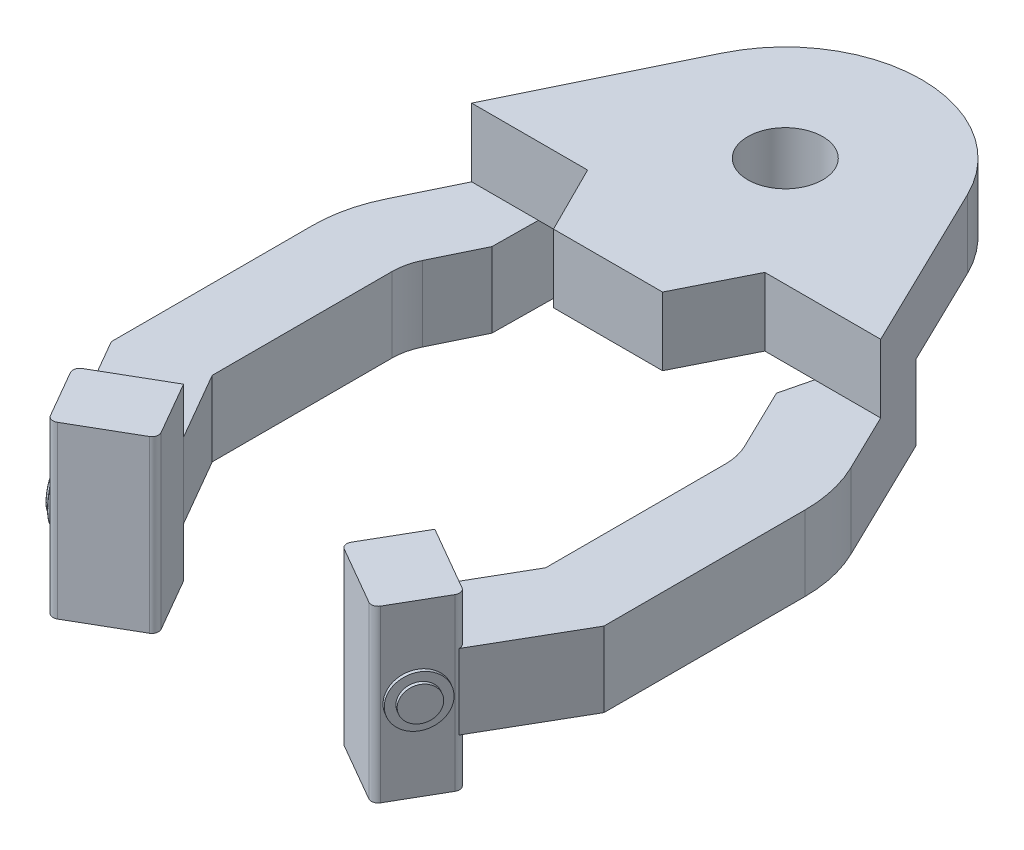
from build123d import *

# Parameters (mm, degrees)
SKETCH1_R           = 0.55
BOSS_EXTRUDE1_DEPTH = 1
BOSS_EXTRUDE3_DEPTH = 1.1
BOSS_EXTRUDE4_DEPTH = 1.25
SKETCH5_R           = 0.375
BOSS_EXTRUDE5_DEPTH = 0.05
SKETCH6_R           = 0.25
BOSS_EXTRUDE6_DEPTH = 0.05
CHAMFER1_SIZE       = 0.75
CHAMFER1_SIZE_2     = 0.5
MIRROR1_START       = -1.1
MIRROR1_DEPTH       = 1.1
MIRROR1_START_2     = -1.8
MIRROR1_2_DEPTH     = 2.5
MIRROR1_START_3     = 6.27611275
MIRROR1_3_OUTLINE_R = 0.375
MIRROR1_3_DEPTH     = 0.05
MIRROR1_START_4     = 6.32611275
MIRROR1_4_OUTLINE_R = 0.25
MIRROR1_4_DEPTH     = 0.05
FILLET2_R           = 0.05
BOSS_EXTRUDE7_DEPTH = 1
FILLET3_R           = 0.1


with BuildPart() as part:
    # Sketch1 → Boss-Extrude1 (new body)
    with BuildSketch(Plane(origin=(0, 0, 0), x_dir=(1, 0, 0), z_dir=(0, 1, 0))):
        with BuildLine():
            Line((-3, -1.6), (-1.799182122, 0.873466479))
            ThreePointArc((-1.799182122, 0.873466479), (0, 2), (1.799182122, 0.873466479))
            Line((1.799182122, 0.873466479), (3, -1.6))
            Line((3, -1.6), (-3, -1.6))
        make_face()
        with Locations(Location((0, 0, 0), (0, 0, 270))):
            Circle(SKETCH1_R, mode=Mode.SUBTRACT)
    extrude(amount=BOSS_EXTRUDE1_DEPTH)

    # Sketch3 → Boss-Extrude3 (add)
    with BuildSketch(Plane(origin=(0, 0, 0), x_dir=(-1, 0, 0), z_dir=(0, -1, 0))):
        with BuildLine():
            Line((2.514520254, -0.6), (3.412657784, -2.45))
            ThreePointArc((3.412657784, -2.45), (3.562510993, -2.875016795), (3.613323348, -3.322803983))
            Line((3.613323348, -3.322803983), (3.613323348, -6.273765877))
            Line((3.613323348, -6.273765877), (2.863323348, -7.572803983))
            Line((2.863323348, -7.572803983), (1.851870719, -6.988841535))
            Line((1.851870719, -6.988841535), (2.445398453, -5.960821345))
            Line((2.445398453, -5.960821345), (2.445398453, -3.322803983))
            ThreePointArc((2.445398453, -3.322803983), (2.424281128, -3.13670618), (2.362002989, -2.960071623))
            Line((2.362002989, -2.960071623), (1.701715763, -1.6))
            Line((1.701715763, -1.6), (2.514520254, -0.6))
        make_face()
    extrude(amount=BOSS_EXTRUDE3_DEPTH)

    # Sketch4 → Boss-Extrude4 (add, symmetric)
    with BuildSketch(Plane(origin=(2.003180044, -0.55, 0.513767997), x_dir=(1, 0, 0), z_dir=(0, 1, 0))):
        Polygon((-3.84639051, -6.470073538), (-4.875163646, -7.064035986), (-4.375163646, -7.930061389), (-3.34639051, -7.336098942), align=None)
    extrude(amount=BOSS_EXTRUDE4_DEPTH, both=True)

    # Sketch5 → Boss-Extrude5 (add)
    with BuildSketch(Plane(origin=(-5.435273078, 0, 3.138056375), x_dir=(0.5000000000000009, 0, 0.8660254037844383), z_dir=(-0.8660254037844382, 0, 0.5000000000000008))):
        with Locations((5.626578953, -0.55)):
            Circle(SKETCH5_R)
    extrude(amount=BOSS_EXTRUDE5_DEPTH)

    # Sketch6 → Boss-Extrude6 (add)
    with BuildSketch(Plane(origin=(-5.478574348, 0, 3.163056375), x_dir=(0.5000000000000008, 0, 0.8660254037844383), z_dir=(-0.8660254037844382, 0, 0.5000000000000007))):
        with Locations((5.626578953, -0.55)):
            Circle(SKETCH6_R)
    extrude(amount=BOSS_EXTRUDE6_DEPTH)

    # Chamfer1
    # the kernel refuses this chamfer: 0.75, 0.5 mm, written as the material it takes off along each edge
    with BuildSketch(Plane(origin=(-1.701715763, 0, 1.6), x_dir=(-0.43673323969900685, 0, 0.899591061172803), z_dir=(0, -1, 0))) as chamfer1_piece_1:
        Polygon((CHAMFER1_SIZE, 0), (-CHAMFER1_SIZE_2 * 0.422618261741, CHAMFER1_SIZE_2 * 0.906307787037), (0, 0), align=None)
    extrude(amount=3.043103543, mode=Mode.SUBTRACT)

    # Mirror1: read off the stored shape, not the designer's step
    # Mirror1 outline → Mirror1 (add)
    with BuildSketch(Plane(origin=(0, 0, 0), x_dir=(1, 0, 0), z_dir=(0, 1, 0)).offset(MIRROR1_START)):
        with BuildLine():
            Line((3.412657784, -2.45), (2.514520254, -0.6))
            Line((2.514520254, -0.6), (2.174766969, -1.01800124))
            Line((2.174766969, -1.01800124), (1.920082383, -2.049795531))
            Line((1.920082383, -2.049795531), (2.362002989, -2.960071623))
            ThreePointArc((2.362002989, -2.960071623), (2.424281128, -3.13670618), (2.445398453, -3.322803983))
            Line((2.445398453, -3.322803983), (2.445398453, -5.960821345))
            Line((2.445398453, -5.960821345), (1.851870719, -6.988841535))
            Line((1.851870719, -6.988841535), (1.843210465, -6.983841535))
            Line((1.843210465, -6.983841535), (1.343210465, -7.849866939))
            Line((1.343210465, -7.849866939), (2.371983602, -8.443829386))
            Line((2.371983602, -8.443829386), (2.871983602, -7.577803983))
            Line((2.871983602, -7.577803983), (2.863323348, -7.572803983))
            Line((2.863323348, -7.572803983), (3.613323348, -6.273765877))
            Line((3.613323348, -6.273765877), (3.613323348, -3.322803983))
            ThreePointArc((3.613323348, -3.322803983), (3.562510993, -2.875016795), (3.412657784, -2.45))
        make_face()
    extrude(amount=MIRROR1_DEPTH)

    # Mirror1 2 outline → Mirror1 2 (add)
    with BuildSketch(Plane(origin=(0, 0, 0), x_dir=(1, 0, 0), z_dir=(0, 1, 0)).offset(MIRROR1_START_2)):
        Polygon((2.871983602, -7.577803983), (1.843210465, -6.983841535), (1.343210465, -7.849866939), (2.371983602, -8.443829386), align=None)
    extrude(amount=MIRROR1_2_DEPTH)

    # Mirror1 3 outline → Mirror1 3 (add)
    with BuildSketch(Plane(origin=(0, 0, 0), x_dir=(0.500000000000001, 0, -0.866025403784438), z_dir=(0.866025403784438, 0, 0.500000000000001)).offset(MIRROR1_START_3)):
        with Locations((-5.626578953, -0.55)):
            Circle(MIRROR1_3_OUTLINE_R)
    extrude(amount=MIRROR1_3_DEPTH)

    # Mirror1 4 outline → Mirror1 4 (add)
    with BuildSketch(Plane(origin=(0, 0, 0), x_dir=(0.500000000000001, 0, -0.866025403784438), z_dir=(0.866025403784438, 0, 0.500000000000001)).offset(MIRROR1_START_4)):
        with Locations((-5.626578953, -0.55)):
            Circle(MIRROR1_4_OUTLINE_R)
    extrude(amount=MIRROR1_4_DEPTH)

    # Fillet2
    fillet2_edges = [part.edges().sort_by_distance(p)[0] for p in [
        (-2.852784872, -0.55, 7.711057158),
        (-2.833586142, -0.55, 7.844310334),
    ]]
    fillet(fillet2_edges, radius=FILLET2_R - 0.0001)  # a hair under: the kernel refuses the full size

    # Sketch7 → Boss-Extrude7 (add)
    with BuildSketch(Plane(origin=(0, 0, 0), x_dir=(1, 0, 0), z_dir=(0, 1, 0))):
        Polygon((-0.8, -2.6), (0.8, -2.6), (1.3, -1.6), (0, -0.8), (-1.3, -1.6), align=None)
    extrude(amount=BOSS_EXTRUDE7_DEPTH)

    # Fillet3
    # the kernel refuses this fillet: 0.1 mm, written as the material it takes off along each edge
    with BuildSketch(Plane(origin=(2.871983602, -1.1, 7.577803983), x_dir=(-0.8660254028383251, 0, -0.5000000016387168), z_dir=(0, 1, 0))) as fillet3_piece_1_section:
        with BuildLine():
            CenterArc((FILLET3_R * 0.9999999985, FILLET3_R), FILLET3_R, 180.000000086, 89.999999914)
            Line((-FILLET3_R * 1.50001066602e-09, FILLET3_R * 0.9999999985), (0, 0))
            Line((0, 0), (FILLET3_R * 0.9999999985, 0))
        make_face()
    fillet3_piece_1 = extrude(amount=1.1, mode=Mode.PRIVATE)
    fillet3_piece_1 = split(fillet3_piece_1, bisect_by=Plane(origin=(2.863323348, -1.1, 7.572803983), z_dir=(0.8660254038383292, 0, 0.49999999990665916)), keep=Keep.TOP, mode=Mode.PRIVATE)
    add(fillet3_piece_1, mode=Mode.SUBTRACT)
    with BuildSketch(Plane(origin=(2.371983602, 0.95, 8.443829386), x_dir=(0.5000000003396727, 0, -0.8660254035883286), z_dir=(0, -1, 0)), Plane(origin=(1.343210465, -2.05, 7.849866939), x_dir=(0.4999999999066601, 0, -0.8660254038383285), z_dir=(0, 1, 0)), Plane(origin=(-2.371983602, -2.05, 8.443829386), x_dir=(-0.5000000000000007, 0, -0.8660254037844383), z_dir=(0, 1, 0))) as fillet3_piece_2:
        with BuildLine():
            CenterArc((FILLET3_R, -FILLET3_R), FILLET3_R, 90, 89.999999953)
            Line((0, -FILLET3_R), (0, 0))
            Line((0, 0), (FILLET3_R, 0))
        make_face()
    extrude(amount=3, mode=Mode.SUBTRACT)
    with BuildSketch(Plane(origin=(-2.871983602, -2.05, 7.577803983), x_dir=(0.5000000000000002, 0, 0.8660254037844386), z_dir=(0, 1, 0))) as fillet3_piece_3_section:
        with BuildLine():
            CenterArc((FILLET3_R, FILLET3_R), FILLET3_R, 180, 90)
            Line((0, FILLET3_R), (0, 0))
            Line((0, 0), (FILLET3_R, 0))
        make_face()
    fillet3_piece_3 = extrude(amount=3, mode=Mode.PRIVATE)
    fillet3_piece_3 = split(fillet3_piece_3, bisect_by=Plane(origin=(-2.871983602, -1.1, 7.577803983), z_dir=(0, -1, 0)), keep=Keep.TOP, mode=Mode.PRIVATE)
    fillet3_piece_3 = split(fillet3_piece_3, bisect_by=Plane(origin=(-2.863323348, -2.05, 7.572803983), z_dir=(-0.8660254037844362, 0, 0.5000000000000044)), keep=Keep.TOP, mode=Mode.PRIVATE)
    add(fillet3_piece_3, mode=Mode.SUBTRACT)
    with BuildSketch(Plane(origin=(-2.871983602, -2.05, 7.577803983), x_dir=(0.5000000000000002, 0, 0.8660254037844386), z_dir=(0, 1, 0))) as fillet3_piece_4_section:
        with BuildLine():
            CenterArc((FILLET3_R, FILLET3_R), FILLET3_R, 180, 90)
            Line((0, FILLET3_R), (0, 0))
            Line((0, 0), (FILLET3_R, 0))
        make_face()
    fillet3_piece_4 = extrude(amount=3, mode=Mode.PRIVATE)
    fillet3_piece_4 = split(fillet3_piece_4, bisect_by=Plane(origin=(-2.871983602, -1.1, 7.577803983), z_dir=(0, -1, 0)), keep=Keep.TOP, mode=Mode.PRIVATE)
    fillet3_piece_4 = split(fillet3_piece_4, bisect_by=Plane(origin=(-2.863323348, -2.05, 7.572803983), z_dir=(0.8660254037844362, 0, -0.5000000000000044)), keep=Keep.TOP, mode=Mode.PRIVATE)
    add(fillet3_piece_4, mode=Mode.SUBTRACT)
    with BuildSketch(Plane(origin=(-2.871983602, -2.05, 7.577803983), x_dir=(0.5000000000000002, 0, 0.8660254037844386), z_dir=(0, 1, 0))) as fillet3_piece_5_section:
        with BuildLine():
            CenterArc((FILLET3_R, FILLET3_R), FILLET3_R, 180, 90)
            Line((0, FILLET3_R), (0, 0))
            Line((0, 0), (FILLET3_R, 0))
        make_face()
    fillet3_piece_5 = extrude(amount=3, mode=Mode.PRIVATE)
    fillet3_piece_5 = split(fillet3_piece_5, bisect_by=Plane(origin=(-2.871983602, 0, 7.577803983), z_dir=(0, -1, 0)), keep=Keep.TOP, mode=Mode.PRIVATE)
    fillet3_piece_5 = split(fillet3_piece_5, bisect_by=Plane(origin=(-2.871983602, -1.1, 7.577803983), z_dir=(0, 1, 0)), keep=Keep.TOP, mode=Mode.PRIVATE)
    fillet3_piece_5 = split(fillet3_piece_5, bisect_by=Plane(origin=(-2.863323348, -2.05, 7.572803983), z_dir=(-0.8660254037844362, 0, 0.5000000000000044)), keep=Keep.TOP, mode=Mode.PRIVATE)
    add(fillet3_piece_5, mode=Mode.SUBTRACT)
    with BuildSketch(Plane(origin=(-2.871983602, -2.05, 7.577803983), x_dir=(0.5000000000000002, 0, 0.8660254037844386), z_dir=(0, 1, 0))) as fillet3_piece_6_section:
        with BuildLine():
            CenterArc((FILLET3_R, FILLET3_R), FILLET3_R, 180, 90)
            Line((0, FILLET3_R), (0, 0))
            Line((0, 0), (FILLET3_R, 0))
        make_face()
    fillet3_piece_6 = extrude(amount=3, mode=Mode.PRIVATE)
    fillet3_piece_6 = split(fillet3_piece_6, bisect_by=Plane(origin=(-2.871983602, 0, 7.577803983), z_dir=(0, 1, 0)), keep=Keep.TOP, mode=Mode.PRIVATE)
    fillet3_piece_6 = split(fillet3_piece_6, bisect_by=Plane(origin=(-2.863323348, -2.05, 7.572803983), z_dir=(-0.8660254037844362, 0, 0.5000000000000044)), keep=Keep.TOP, mode=Mode.PRIVATE)
    add(fillet3_piece_6, mode=Mode.SUBTRACT)
    with BuildSketch(Plane(origin=(-2.871983602, -2.05, 7.577803983), x_dir=(0.5000000000000002, 0, 0.8660254037844386), z_dir=(0, 1, 0))) as fillet3_piece_7_section:
        with BuildLine():
            CenterArc((FILLET3_R, FILLET3_R), FILLET3_R, 180, 90)
            Line((0, FILLET3_R), (0, 0))
            Line((0, 0), (FILLET3_R, 0))
        make_face()
    fillet3_piece_7 = extrude(amount=3, mode=Mode.PRIVATE)
    fillet3_piece_7 = split(fillet3_piece_7, bisect_by=Plane(origin=(-2.871983602, 0, 7.577803983), z_dir=(0, 1, 0)), keep=Keep.TOP, mode=Mode.PRIVATE)
    fillet3_piece_7 = split(fillet3_piece_7, bisect_by=Plane(origin=(-2.863323348, -2.05, 7.572803983), z_dir=(0.8660254037844362, 0, -0.5000000000000044)), keep=Keep.TOP, mode=Mode.PRIVATE)
    add(fillet3_piece_7, mode=Mode.SUBTRACT)
    with BuildSketch(Plane(origin=(-1.343210465, 0.95, 7.849866939), x_dir=(-0.8660254037844438, 0, 0.4999999999999912), z_dir=(0, -1, 0))) as fillet3_piece_8:
        with BuildLine():
            CenterArc((FILLET3_R, FILLET3_R), FILLET3_R, 180, 90)
            Line((0, FILLET3_R), (0, 0))
            Line((0, 0), (FILLET3_R, 0))
        make_face()
    extrude(amount=3, mode=Mode.SUBTRACT)
    with BuildSketch(Plane(origin=(2.871983602, -2.05, 7.577803983), x_dir=(-0.866025403632075, 0, -0.5000000002639015), z_dir=(0, 1, 0)), Plane(origin=(2.871983602, 0, 7.577803983), x_dir=(-0.866025403632075, 0, -0.5000000002639015), z_dir=(0, 1, 0))) as fillet3_piece_9:
        with BuildLine():
            CenterArc((FILLET3_R, FILLET3_R), FILLET3_R, 179.999999995, 90.000000005)
            Line((0, FILLET3_R), (0, 0))
            Line((0, 0), (FILLET3_R, 0))
        make_face()
    extrude(amount=0.95, mode=Mode.SUBTRACT)


solid = part.part
